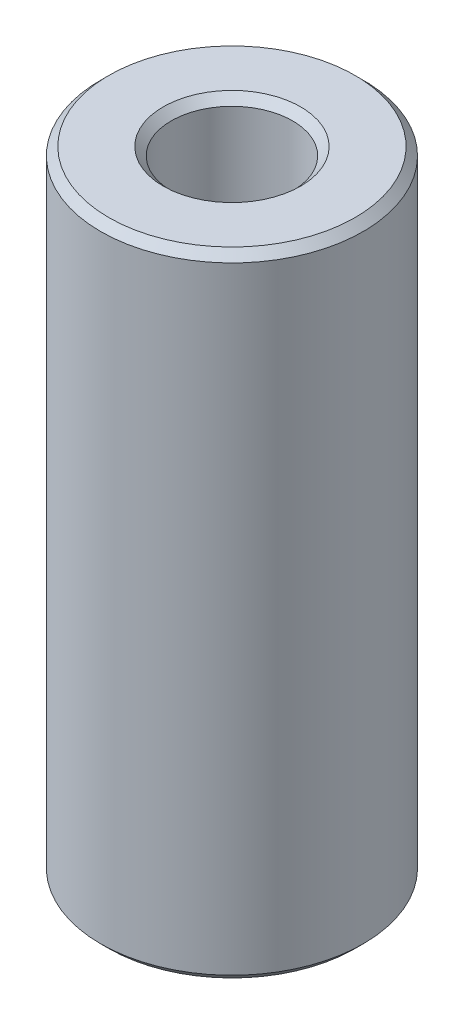
from build123d import *

# Parameters (mm, degrees)
SKETCH1_R           = 15
BOSS_EXTRUDE1_DEPTH = 72.360674656
SKETCH2_R           = 6.933993946
CUT_EXTRUDE1_DEPTH  = 76.406015919
CHAMFER1_SIZE       = 0.922647919


with BuildPart() as part:
    # Sketch1 → Boss-Extrude1 (new body)
    with BuildSketch(Plane(origin=(0, 0, 0), x_dir=(1, 0, 0), z_dir=(0, 1, 0))):
        Circle(SKETCH1_R)
    extrude(amount=BOSS_EXTRUDE1_DEPTH)

    # Sketch2 → Cut-Extrude1 (cut, through all)
    with BuildSketch(Plane(origin=(0, 0, 0), x_dir=(1, 0, 0), z_dir=(0, 1, 0))):
        Circle(SKETCH2_R)
    extrude(amount=CUT_EXTRUDE1_DEPTH, mode=Mode.SUBTRACT)

    # Chamfer1
    chamfer1_edges = [part.edges().sort_by_distance(p)[0] for p in [
        (-6.933993946, 72.360674656, 0),
        (-6.933993946, 0, 0),
        (-15, 0, 0),
        (-15, 72.360674656, 0),
    ]]
    chamfer(chamfer1_edges, length=CHAMFER1_SIZE)


solid = part.part
